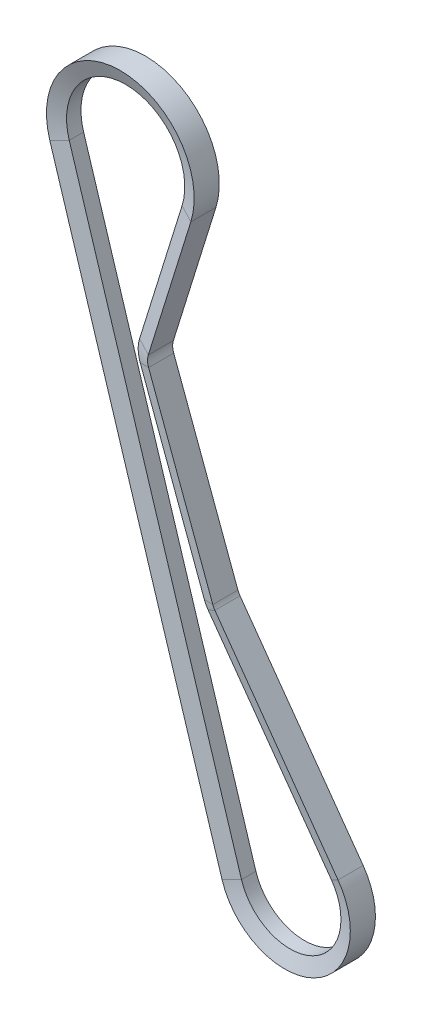
from build123d import *


with BuildPart() as part:
    # Sweep1: sweep along a path in Sketch2
    with BuildLine(Plane.XY) as sweep1_path:
        Line((-23.753391587, -7.385256583), (-89.063643849, 202.673795411))
        ThreePointArc((-89.063643849, 202.673795411), (-62.318595318, 238.986847015), (-35.593166376, 202.659353493))
        Line((-35.593166376, 202.659353493), (-51.717025405, 150.898408572))
        ThreePointArc((-51.717025405, 150.898408572), (-52.002126395, 148.841260133), (-51.608231819, 146.802145292))
        Line((-51.608231819, 146.802145292), (-27.271309976, 81.168965915))
        ThreePointArc((-27.271309976, 81.168965915), (-26.92517078, 80.397429367), (-26.479583893, 79.678726846))
        Line((-26.479583893, 79.678726846), (20.221772466, 14.486046563))
        ThreePointArc((20.221772466, 14.486046563), (11.077299253, -22.272383527), (-23.753391587, -7.385256583))
    # Sketch3 → Sweep1 (sweep)
    with BuildSketch(Plane(origin=(20.221772466, 14.486046563, 0), x_dir=(-0.812935575411067, -0.5823536298771369, 0), z_dir=(0.582353629877137, -0.8129355754110671, 0))):
        Polygon((0, -4.7625), (0, 4.7625), (5.588, 2.728634331), (5.588, -2.728634331), align=None)
    sweep(path=sweep1_path.line)


solid = part.part
